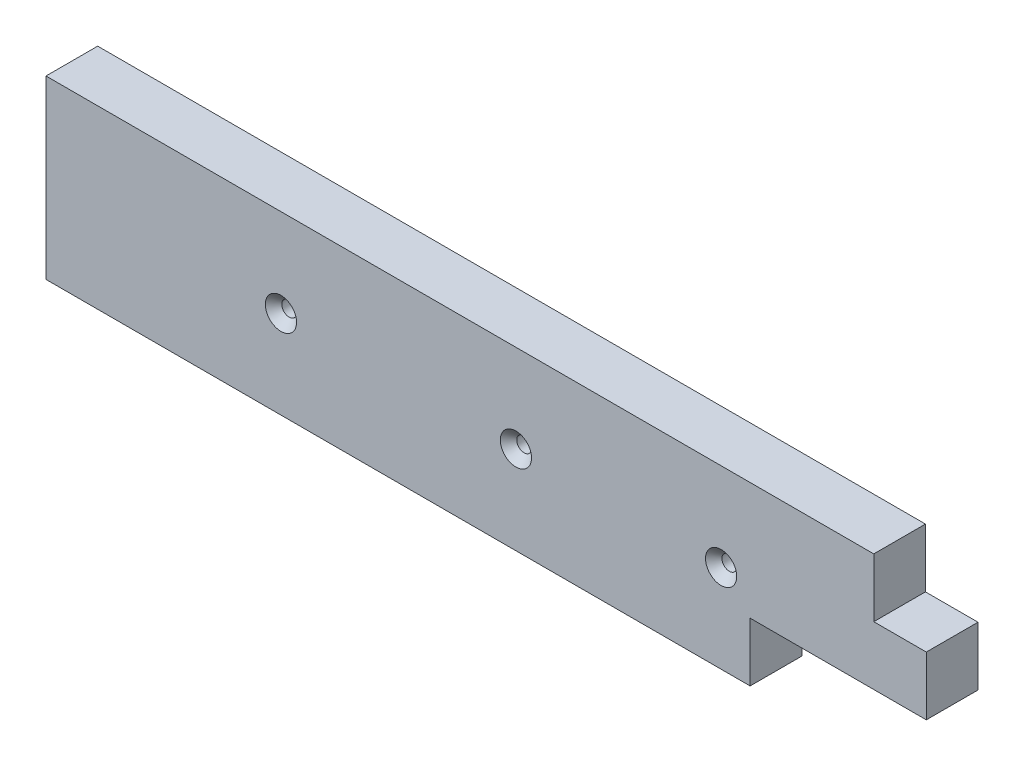
from build123d import *

# Parameters (mm, degrees)
SKETCH1_W                                            = 380.651745172
SKETCH1_H                                            = 22.352
BOSS_EXTRUDE1_DEPTH                                  = 38.1
CSK_FOR_M6_HEX_SOCKET_COUNTERSUNK_HEAD_S_D           = 6.4
CSK_FOR_M6_HEX_SOCKET_COUNTERSUNK_HEAD_S_CSINK_D     = 13.5
CSK_FOR_M6_HEX_SOCKET_COUNTERSUNK_HEAD_S_CSINK_ANGLE = 90
CSK_FOR_M6_HEX_SOCKET_COUNTERSUNK_HE_2_D             = 6.4
CSK_FOR_M6_HEX_SOCKET_COUNTERSUNK_HE_2_CSINK_D       = 13.5
CSK_FOR_M6_HEX_SOCKET_COUNTERSUNK_HE_2_CSINK_ANGLE   = 90
CSK_FOR_M6_HEX_SOCKET_COUNTERSUNK_HE_3_D             = 6.4
CSK_FOR_M6_HEX_SOCKET_COUNTERSUNK_HE_3_CSINK_D       = 13.5
CSK_FOR_M6_HEX_SOCKET_COUNTERSUNK_HE_3_CSINK_ANGLE   = 90
SKETCH3_W                                            = 22.71951641
SKETCH3_H                                            = 25.4
SKETCH3_W_2                                          = 76.186487456
CUT_EXTRUDE1_DEPTH                                   = 196.384645455


with BuildPart() as part:
    # Sketch1 → Boss-Extrude1 (new, symmetric)
    with BuildSketch(Plane(origin=(0, 0, 0), x_dir=(1, 0, 0), z_dir=(0, 1, 0))):
        Rectangle(SKETCH1_W, SKETCH1_H)
    extrude(amount=BOSS_EXTRUDE1_DEPTH, both=True)

    # CSK for M6 Hex Socket Countersunk Head S (through all)
    with Locations(Plane.XY.offset(11.176)):
        with Locations((-88.725872586, 0)):
            CounterSinkHole(CSK_FOR_M6_HEX_SOCKET_COUNTERSUNK_HEAD_S_D / 2, CSK_FOR_M6_HEX_SOCKET_COUNTERSUNK_HEAD_S_CSINK_D / 2, counter_sink_angle=CSK_FOR_M6_HEX_SOCKET_COUNTERSUNK_HEAD_S_CSINK_ANGLE)

    # CSK for M6 Hex Socket Countersunk He 2 (through all)
    with Locations(Plane.XY.offset(11.176)):
        with Locations((12.874127414, 0)):
            CounterSinkHole(CSK_FOR_M6_HEX_SOCKET_COUNTERSUNK_HE_2_D / 2, CSK_FOR_M6_HEX_SOCKET_COUNTERSUNK_HE_2_CSINK_D / 2, counter_sink_angle=CSK_FOR_M6_HEX_SOCKET_COUNTERSUNK_HE_2_CSINK_ANGLE)

    # CSK for M6 Hex Socket Countersunk He 3 (through all)
    with Locations(Plane.XY.offset(11.176)):
        with Locations((101.6, 0)):
            CounterSinkHole(CSK_FOR_M6_HEX_SOCKET_COUNTERSUNK_HE_3_D / 2, CSK_FOR_M6_HEX_SOCKET_COUNTERSUNK_HE_3_CSINK_D / 2, counter_sink_angle=CSK_FOR_M6_HEX_SOCKET_COUNTERSUNK_HE_3_CSINK_ANGLE)

    # Sketch3 → Cut-Extrude1 (cut, through all)
    with BuildSketch(Plane.XY.offset(11.176)):
        with Locations((178.966114381, 25.4)):
            Rectangle(SKETCH3_W, SKETCH3_H)
        with Locations((152.232628858, -25.4)):
            Rectangle(SKETCH3_W_2, SKETCH3_H)
    extrude(amount=-CUT_EXTRUDE1_DEPTH, mode=Mode.SUBTRACT)


solid = part.part
